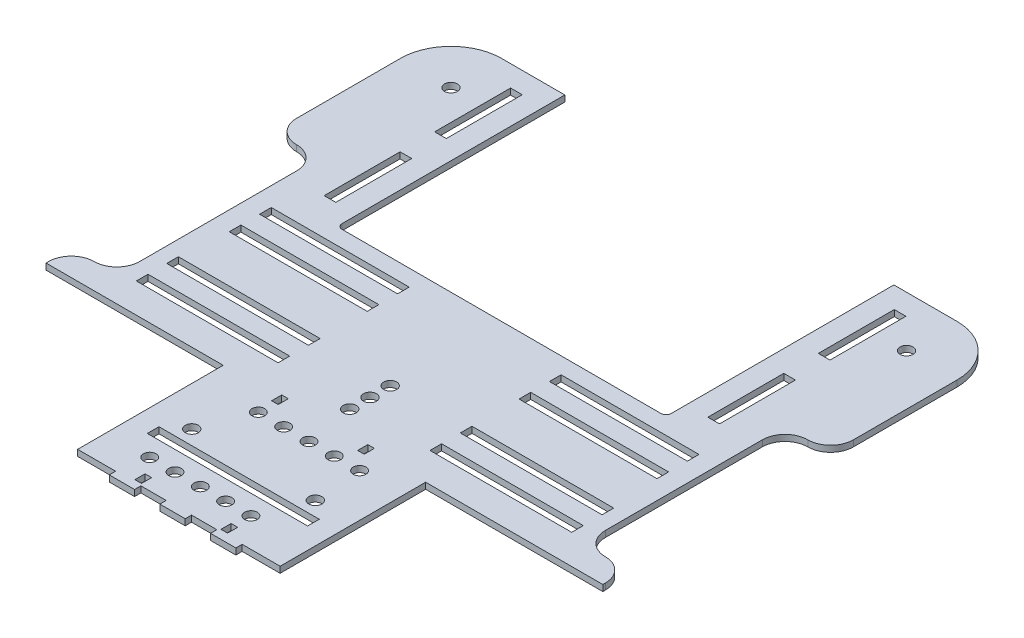
from build123d import *

# Parameters (mm, degrees)
SKETCH1_W                           = 279.4
SKETCH1_H                           = 279.4
BOSS_EXTRUDE1_DEPTH                 = 3.0988
WHEEL_WELLS_CUT_EXTRUDE2_REACH      = 199.59
SKETCH4_W                           = 22.86
SKETCH4_H                           = 101.6
FILLET1_START                       = -1
FILLET1_DEPTH                       = 5
FILLET1_2_DEPTH                     = 3.0988
SHAFT_HOLES_CUT_EXTRUDE4_REACH      = 199.59
SKETCH6_R                           = 3.2639
FILLET2_R                           = 25.4
COLLECTOR_CUTOUT_CUT_EXTRUDE5_REACH = 199.59
SKETCH7_W                           = 165.1
SKETCH7_H                           = 114.3
CUT_EXTRUDE11_REACH                 = 199.59
SKETCH26_W                          = 88.9
SKETCH26_H                          = 76.2
FILLET6_R                           = 2.54
CUT_EXTRUDE15_REACH                 = 199.59
SKETCH36_W                          = 71.12
SKETCH36_H                          = 5.842
SKETCH36_W_2                        = 69.208206015
CUT_EXTRUDE16_REACH                 = 199.59
SKETCH37_W                          = 19.05
SKETCH37_H                          = 3.175
SKETCH37_W_2                        = 12.7
CUT_EXTRUDE17_REACH                 = 199.59
SKETCH35_W                          = 3.302
SKETCH35_H                          = 5.08
SKETCH35_W_2                        = 80.428869842
SKETCH35_H_2                        = 5.842
CUT_EXTRUDE18_REACH                 = 199.59
SKETCH38_R                          = 3.175
CUT_EXTRUDE19_REACH                 = 199.59
SKETCH39_W                          = 5.842
SKETCH39_H                          = 38.1


with BuildPart() as part:
    # Sketch1 → Boss-Extrude1 (new body)
    with BuildSketch(Plane(origin=(0, 0, 0), x_dir=(1, 0, 0), z_dir=(0, 1, 0))):
        Rectangle(SKETCH1_W, SKETCH1_H)
    extrude(amount=BOSS_EXTRUDE1_DEPTH)

    # Sketch4 → WHEEL_WELLS_Cut-Extrude2 (cut, up to next)
    with BuildSketch(Plane(origin=(0, 3.0988, 0), x_dir=(1, 0, 0), z_dir=(0, 1, 0)), mode=Mode.PRIVATE) as wheel_wells_cut_extrude2_sk1:
        with Locations((-128.27, 0)):
            Rectangle(SKETCH4_W, SKETCH4_H)
    wheel_wells_cut_extrude2_tool1 = extrude(wheel_wells_cut_extrude2_sk1.sketch, amount=-WHEEL_WELLS_CUT_EXTRUDE2_REACH, mode=Mode.PRIVATE) & part.part
    # Sketch4 → WHEEL_WELLS_Cut-Extrude2 (cut, up to next)
    with BuildSketch(Plane(origin=(0, 3.0988, 0), x_dir=(1, 0, 0), z_dir=(0, 1, 0)), mode=Mode.PRIVATE) as wheel_wells_cut_extrude2_sk2:
        with Locations((128.27, 0)):
            Rectangle(SKETCH4_W, SKETCH4_H)
    wheel_wells_cut_extrude2_tool2 = extrude(wheel_wells_cut_extrude2_sk2.sketch, amount=-WHEEL_WELLS_CUT_EXTRUDE2_REACH, mode=Mode.PRIVATE) & part.part
    add(wheel_wells_cut_extrude2_tool1.solids().sort_by_distance((-128.27, 3.0988, 0))[0], mode=Mode.SUBTRACT)
    add(wheel_wells_cut_extrude2_tool2.solids().sort_by_distance((128.27, 3.0988, 0))[0], mode=Mode.SUBTRACT)

    # Fillet1: read off the stored shape, not the designer's step
    # Fillet1 outline → Fillet1 (cut)
    with BuildSketch(Plane(origin=(0, 0, 0), x_dir=(1, 0, 0), z_dir=(0, 1, 0)).offset(FILLET1_START)):
        with BuildLine():
            ThreePointArc((-139.7, -62.23), (-136.352230509, -54.147769491), (-128.27, -50.8))
            Line((-128.27, -50.8), (-139.7, -50.8))
            Line((-139.7, -50.8), (-139.7, -62.23))
        make_face()
        with BuildLine():
            ThreePointArc((-128.27, 50.8), (-136.352230509, 54.147769491), (-139.7, 62.23))
            Line((-139.7, 62.23), (-139.7, 50.8))
            Line((-139.7, 50.8), (-128.27, 50.8))
        make_face()
        with BuildLine():
            Line((139.7, -50.8), (128.27, -50.8))
            ThreePointArc((128.27, -50.8), (136.352230509, -54.147769491), (139.7, -62.23))
            Line((139.7, -62.23), (139.7, -50.8))
        make_face()
        with BuildLine():
            ThreePointArc((139.7, 62.23), (136.352230509, 54.147769491), (128.27, 50.8))
            Line((128.27, 50.8), (139.7, 50.8))
            Line((139.7, 50.8), (139.7, 62.23))
        make_face()
    extrude(amount=FILLET1_DEPTH, mode=Mode.SUBTRACT)

    # Fillet1 2 outline → Fillet1 2 (add)
    with BuildSketch(Plane(origin=(0, 0, 0), x_dir=(1, 0, 0), z_dir=(0, 1, 0))):
        with BuildLine():
            Line((-116.84, -50.8), (-116.84, -39.37))
            ThreePointArc((-116.84, -39.37), (-120.187769491, -47.452230509), (-128.27, -50.8))
            Line((-128.27, -50.8), (-116.84, -50.8))
        make_face()
        with BuildLine():
            Line((-116.84, 50.8), (-128.27, 50.8))
            ThreePointArc((-128.27, 50.8), (-120.187769491, 47.452230509), (-116.84, 39.37))
            Line((-116.84, 39.37), (-116.84, 50.8))
        make_face()
        with BuildLine():
            Line((116.84, -50.8), (128.27, -50.8))
            ThreePointArc((128.27, -50.8), (120.187769491, -47.452230509), (116.84, -39.37))
            Line((116.84, -39.37), (116.84, -50.8))
        make_face()
        with BuildLine():
            Line((116.84, 50.8), (116.84, 39.37))
            ThreePointArc((116.84, 39.37), (120.187769491, 47.452230509), (128.27, 50.8))
            Line((128.27, 50.8), (116.84, 50.8))
        make_face()
    extrude(amount=FILLET1_2_DEPTH)

    # Sketch6 → SHAFT_HOLES_Cut-Extrude4 (cut, up to next)
    with BuildSketch(Plane(origin=(0, 3.0988, 0), x_dir=(1, 0, 0), z_dir=(0, 1, 0)), mode=Mode.PRIVATE) as shaft_holes_cut_extrude4_sk1:
        with Locations(Location((-114.3, 114.3, 0), (0, 0, 270))):
            Circle(SKETCH6_R)
    shaft_holes_cut_extrude4_tool1 = extrude(shaft_holes_cut_extrude4_sk1.sketch, amount=-SHAFT_HOLES_CUT_EXTRUDE4_REACH, mode=Mode.PRIVATE) & part.part
    # Sketch6 → SHAFT_HOLES_Cut-Extrude4 (cut, up to next)
    with BuildSketch(Plane(origin=(0, 3.0988, 0), x_dir=(1, 0, 0), z_dir=(0, 1, 0)), mode=Mode.PRIVATE) as shaft_holes_cut_extrude4_sk2:
        with Locations(Location((114.3, 114.3, 0), (0, 0, 270))):
            Circle(SKETCH6_R)
    shaft_holes_cut_extrude4_tool2 = extrude(shaft_holes_cut_extrude4_sk2.sketch, amount=-SHAFT_HOLES_CUT_EXTRUDE4_REACH, mode=Mode.PRIVATE) & part.part
    # Sketch6 → SHAFT_HOLES_Cut-Extrude4 (cut, up to next)
    with BuildSketch(Plane(origin=(0, 3.0988, 0), x_dir=(1, 0, 0), z_dir=(0, 1, 0)), mode=Mode.PRIVATE) as shaft_holes_cut_extrude4_sk3:
        with Locations(Location((114.3, -114.3, 0), (0, 0, 270))):
            Circle(SKETCH6_R)
    shaft_holes_cut_extrude4_tool3 = extrude(shaft_holes_cut_extrude4_sk3.sketch, amount=-SHAFT_HOLES_CUT_EXTRUDE4_REACH, mode=Mode.PRIVATE) & part.part
    # Sketch6 → SHAFT_HOLES_Cut-Extrude4 (cut, up to next)
    with BuildSketch(Plane(origin=(0, 3.0988, 0), x_dir=(1, 0, 0), z_dir=(0, 1, 0)), mode=Mode.PRIVATE) as shaft_holes_cut_extrude4_sk4:
        with Locations(Location((-114.3, -114.3, 0), (0, 0, 270))):
            Circle(SKETCH6_R)
    shaft_holes_cut_extrude4_tool4 = extrude(shaft_holes_cut_extrude4_sk4.sketch, amount=-SHAFT_HOLES_CUT_EXTRUDE4_REACH, mode=Mode.PRIVATE) & part.part
    # Sketch6 → SHAFT_HOLES_Cut-Extrude4 (cut, up to next)
    with BuildSketch(Plane(origin=(0, 3.0988, 0), x_dir=(1, 0, 0), z_dir=(0, 1, 0)), mode=Mode.PRIVATE) as shaft_holes_cut_extrude4_sk5:
        with Locations(Location((0, -50.8, 0), (0, 0, 270))):
            Circle(SKETCH6_R)
    shaft_holes_cut_extrude4_tool5 = extrude(shaft_holes_cut_extrude4_sk5.sketch, amount=-SHAFT_HOLES_CUT_EXTRUDE4_REACH, mode=Mode.PRIVATE) & part.part
    # Sketch6 → SHAFT_HOLES_Cut-Extrude4 (cut, up to next)
    with BuildSketch(Plane(origin=(0, 3.0988, 0), x_dir=(1, 0, 0), z_dir=(0, 1, 0)), mode=Mode.PRIVATE) as shaft_holes_cut_extrude4_sk6:
        with Locations(Location((0, -40.64, 0), (0, 0, 270))):
            Circle(SKETCH6_R)
    shaft_holes_cut_extrude4_tool6 = extrude(shaft_holes_cut_extrude4_sk6.sketch, amount=-SHAFT_HOLES_CUT_EXTRUDE4_REACH, mode=Mode.PRIVATE) & part.part
    # Sketch6 → SHAFT_HOLES_Cut-Extrude4 (cut, up to next)
    with BuildSketch(Plane(origin=(0, 3.0988, 0), x_dir=(1, 0, 0), z_dir=(0, 1, 0)), mode=Mode.PRIVATE) as shaft_holes_cut_extrude4_sk7:
        with Locations(Location((0, -30.48, 0), (0, 0, 270))):
            Circle(SKETCH6_R)
    shaft_holes_cut_extrude4_tool7 = extrude(shaft_holes_cut_extrude4_sk7.sketch, amount=-SHAFT_HOLES_CUT_EXTRUDE4_REACH, mode=Mode.PRIVATE) & part.part
    # Sketch6 → SHAFT_HOLES_Cut-Extrude4 (cut, up to next)
    with BuildSketch(Plane(origin=(0, 3.0988, 0), x_dir=(1, 0, 0), z_dir=(0, 1, 0)), mode=Mode.PRIVATE) as shaft_holes_cut_extrude4_sk8:
        with Locations(Location((-30.988, -99.06, 0), (0, 0, 270))):
            Circle(SKETCH6_R)
    shaft_holes_cut_extrude4_tool8 = extrude(shaft_holes_cut_extrude4_sk8.sketch, amount=-SHAFT_HOLES_CUT_EXTRUDE4_REACH, mode=Mode.PRIVATE) & part.part
    # Sketch6 → SHAFT_HOLES_Cut-Extrude4 (cut, up to next)
    with BuildSketch(Plane(origin=(0, 3.0988, 0), x_dir=(1, 0, 0), z_dir=(0, 1, 0)), mode=Mode.PRIVATE) as shaft_holes_cut_extrude4_sk9:
        with Locations(Location((30.988, -99.06, 0), (0, 0, 270))):
            Circle(SKETCH6_R)
    shaft_holes_cut_extrude4_tool9 = extrude(shaft_holes_cut_extrude4_sk9.sketch, amount=-SHAFT_HOLES_CUT_EXTRUDE4_REACH, mode=Mode.PRIVATE) & part.part
    add(shaft_holes_cut_extrude4_tool1.solids().sort_by_distance((-114.3, 3.0988, -114.3))[0], mode=Mode.SUBTRACT)
    add(shaft_holes_cut_extrude4_tool2.solids().sort_by_distance((114.3, 3.0988, -114.3))[0], mode=Mode.SUBTRACT)
    add(shaft_holes_cut_extrude4_tool3.solids().sort_by_distance((114.3, 3.0988, 114.3))[0], mode=Mode.SUBTRACT)
    add(shaft_holes_cut_extrude4_tool4.solids().sort_by_distance((-114.3, 3.0988, 114.3))[0], mode=Mode.SUBTRACT)
    add(shaft_holes_cut_extrude4_tool5.solids().sort_by_distance((0, 3.0988, 50.8))[0], mode=Mode.SUBTRACT)
    add(shaft_holes_cut_extrude4_tool6.solids().sort_by_distance((0, 3.0988, 40.64))[0], mode=Mode.SUBTRACT)
    add(shaft_holes_cut_extrude4_tool7.solids().sort_by_distance((0, 3.0988, 30.48))[0], mode=Mode.SUBTRACT)
    add(shaft_holes_cut_extrude4_tool8.solids().sort_by_distance((-30.988, 3.0988, 99.06))[0], mode=Mode.SUBTRACT)
    add(shaft_holes_cut_extrude4_tool9.solids().sort_by_distance((30.988, 3.0988, 99.06))[0], mode=Mode.SUBTRACT)

    # Fillet2
    fillet2_edges = [part.edges().sort_by_distance(p)[0] for p in [
        (-139.7, 1.5494, -139.7),
        (139.7, 1.5494, -139.7),
        (139.7, 1.5494, 139.7),
        (-139.7, 1.5494, 139.7),
    ]]
    fillet(fillet2_edges, radius=FILLET2_R)

    # Sketch7 → COLLECTOR_CUTOUT_Cut-Extrude5 (cut, up to next)
    with BuildSketch(Plane(origin=(0, 3.0988, 0), x_dir=(1, 0, 0), z_dir=(0, 1, 0)), mode=Mode.PRIVATE) as collector_cutout_cut_extrude5_sk1:
        with Locations((0, 82.55)):
            Rectangle(SKETCH7_W, SKETCH7_H)
    collector_cutout_cut_extrude5_tool1 = extrude(collector_cutout_cut_extrude5_sk1.sketch, amount=-COLLECTOR_CUTOUT_CUT_EXTRUDE5_REACH, mode=Mode.PRIVATE) & part.part
    add(collector_cutout_cut_extrude5_tool1.solids().sort_by_distance((0, 3.0988, -82.55))[0], mode=Mode.SUBTRACT)

    # Sketch26 → Cut-Extrude11 (cut, up to next)
    with BuildSketch(Plane(origin=(0, 3.0988, 0), x_dir=(1, 0, 0), z_dir=(0, 1, 0)), mode=Mode.PRIVATE) as cut_extrude11_sk1:
        with Locations((-95.25, -101.6)):
            Rectangle(SKETCH26_W, SKETCH26_H)
    cut_extrude11_tool1 = extrude(cut_extrude11_sk1.sketch, amount=-CUT_EXTRUDE11_REACH, mode=Mode.PRIVATE) & part.part
    # Sketch26 → Cut-Extrude11 (cut, up to next)
    with BuildSketch(Plane(origin=(0, 3.0988, 0), x_dir=(1, 0, 0), z_dir=(0, 1, 0)), mode=Mode.PRIVATE) as cut_extrude11_sk2:
        with Locations((95.25, -101.6)):
            Rectangle(SKETCH26_W, SKETCH26_H)
    cut_extrude11_tool2 = extrude(cut_extrude11_sk2.sketch, amount=-CUT_EXTRUDE11_REACH, mode=Mode.PRIVATE) & part.part
    add(cut_extrude11_tool1.solids().sort_by_distance((-95.25, 3.0988, 101.6))[0], mode=Mode.SUBTRACT)
    add(cut_extrude11_tool2.solids().sort_by_distance((95.25, 3.0988, 101.6))[0], mode=Mode.SUBTRACT)

    # Fillet6
    fillet6_edges = [part.edges().sort_by_distance(p)[0] for p in [
        (-82.55, 1.5494, -25.4),
        (82.55, 1.5494, -25.4),
    ]]
    fillet(fillet6_edges, radius=FILLET6_R)

    # Sketch36 → Cut-Extrude15 (cut, up to next)
    with BuildSketch(Plane(origin=(0, 3.0988, 0), x_dir=(1, 0, 0), z_dir=(0, 1, 0)), mode=Mode.PRIVATE) as cut_extrude15_sk1:
        with Locations((-73.66, -30.48)):
            Rectangle(SKETCH36_W, SKETCH36_H)
    cut_extrude15_tool1 = extrude(cut_extrude15_sk1.sketch, amount=-CUT_EXTRUDE15_REACH, mode=Mode.PRIVATE) & part.part
    # Sketch36 → Cut-Extrude15 (cut, up to next)
    with BuildSketch(Plane(origin=(0, 3.0988, 0), x_dir=(1, 0, 0), z_dir=(0, 1, 0)), mode=Mode.PRIVATE) as cut_extrude15_sk2:
        with Locations((-73.66, -45.72)):
            Rectangle(SKETCH36_W, SKETCH36_H)
    cut_extrude15_tool2 = extrude(cut_extrude15_sk2.sketch, amount=-CUT_EXTRUDE15_REACH, mode=Mode.PRIVATE) & part.part
    # Sketch36 → Cut-Extrude15 (cut, up to next)
    with BuildSketch(Plane(origin=(0, 3.0988, 0), x_dir=(1, 0, 0), z_dir=(0, 1, 0)), mode=Mode.PRIVATE) as cut_extrude15_sk3:
        with Locations((73.66, -45.72)):
            Rectangle(SKETCH36_W, SKETCH36_H)
    cut_extrude15_tool3 = extrude(cut_extrude15_sk3.sketch, amount=-CUT_EXTRUDE15_REACH, mode=Mode.PRIVATE) & part.part
    # Sketch36 → Cut-Extrude15 (cut, up to next)
    with BuildSketch(Plane(origin=(0, 3.0988, 0), x_dir=(1, 0, 0), z_dir=(0, 1, 0)), mode=Mode.PRIVATE) as cut_extrude15_sk4:
        with Locations((73.66, -30.48)):
            Rectangle(SKETCH36_W, SKETCH36_H)
    cut_extrude15_tool4 = extrude(cut_extrude15_sk4.sketch, amount=-CUT_EXTRUDE15_REACH, mode=Mode.PRIVATE) & part.part
    # Sketch36 → Cut-Extrude15 (cut, up to next)
    with BuildSketch(Plane(origin=(0, 3.0988, 0), x_dir=(1, 0, 0), z_dir=(0, 1, 0)), mode=Mode.PRIVATE) as cut_extrude15_sk5:
        with Locations((-72.704103008, 14.224)):
            Rectangle(SKETCH36_W_2, SKETCH36_H)
    cut_extrude15_tool5 = extrude(cut_extrude15_sk5.sketch, amount=-CUT_EXTRUDE15_REACH, mode=Mode.PRIVATE) & part.part
    # Sketch36 → Cut-Extrude15 (cut, up to next)
    with BuildSketch(Plane(origin=(0, 3.0988, 0), x_dir=(1, 0, 0), z_dir=(0, 1, 0)), mode=Mode.PRIVATE) as cut_extrude15_sk6:
        with Locations((72.704103008, -1.016)):
            Rectangle(SKETCH36_W_2, SKETCH36_H)
    cut_extrude15_tool6 = extrude(cut_extrude15_sk6.sketch, amount=-CUT_EXTRUDE15_REACH, mode=Mode.PRIVATE) & part.part
    # Sketch36 → Cut-Extrude15 (cut, up to next)
    with BuildSketch(Plane(origin=(0, 3.0988, 0), x_dir=(1, 0, 0), z_dir=(0, 1, 0)), mode=Mode.PRIVATE) as cut_extrude15_sk7:
        with Locations((-72.704103008, -1.016)):
            Rectangle(SKETCH36_W_2, SKETCH36_H)
    cut_extrude15_tool7 = extrude(cut_extrude15_sk7.sketch, amount=-CUT_EXTRUDE15_REACH, mode=Mode.PRIVATE) & part.part
    # Sketch36 → Cut-Extrude15 (cut, up to next)
    with BuildSketch(Plane(origin=(0, 3.0988, 0), x_dir=(1, 0, 0), z_dir=(0, 1, 0)), mode=Mode.PRIVATE) as cut_extrude15_sk8:
        with Locations((72.704103008, 14.224)):
            Rectangle(SKETCH36_W_2, SKETCH36_H)
    cut_extrude15_tool8 = extrude(cut_extrude15_sk8.sketch, amount=-CUT_EXTRUDE15_REACH, mode=Mode.PRIVATE) & part.part
    add(cut_extrude15_tool1.solids().sort_by_distance((-73.66, 3.0988, 30.48))[0], mode=Mode.SUBTRACT)
    add(cut_extrude15_tool2.solids().sort_by_distance((-73.66, 3.0988, 45.72))[0], mode=Mode.SUBTRACT)
    add(cut_extrude15_tool3.solids().sort_by_distance((73.66, 3.0988, 45.72))[0], mode=Mode.SUBTRACT)
    add(cut_extrude15_tool4.solids().sort_by_distance((73.66, 3.0988, 30.48))[0], mode=Mode.SUBTRACT)
    add(cut_extrude15_tool5.solids().sort_by_distance((-72.704103, 3.0988, -14.224))[0], mode=Mode.SUBTRACT)
    add(cut_extrude15_tool6.solids().sort_by_distance((72.704103, 3.0988, 1.016))[0], mode=Mode.SUBTRACT)
    add(cut_extrude15_tool7.solids().sort_by_distance((-72.704103, 3.0988, 1.016))[0], mode=Mode.SUBTRACT)
    add(cut_extrude15_tool8.solids().sort_by_distance((72.704103, 3.0988, -14.224))[0], mode=Mode.SUBTRACT)

    # Sketch37 → Cut-Extrude16 (cut, up to next)
    with BuildSketch(Plane(origin=(0, 3.0988, 0), x_dir=(1, 0, 0), z_dir=(0, 1, 0)), mode=Mode.PRIVATE) as cut_extrude16_sk1:
        with Locations((-41.275, -138.1125)):
            Rectangle(SKETCH37_W, SKETCH37_H)
    cut_extrude16_tool1 = extrude(cut_extrude16_sk1.sketch, amount=-CUT_EXTRUDE16_REACH, mode=Mode.PRIVATE) & part.part
    # Sketch37 → Cut-Extrude16 (cut, up to next)
    with BuildSketch(Plane(origin=(0, 3.0988, 0), x_dir=(1, 0, 0), z_dir=(0, 1, 0)), mode=Mode.PRIVATE) as cut_extrude16_sk2:
        with Locations((-12.7, -138.1125)):
            Rectangle(SKETCH37_W_2, SKETCH37_H)
    cut_extrude16_tool2 = extrude(cut_extrude16_sk2.sketch, amount=-CUT_EXTRUDE16_REACH, mode=Mode.PRIVATE) & part.part
    # Sketch37 → Cut-Extrude16 (cut, up to next)
    with BuildSketch(Plane(origin=(0, 3.0988, 0), x_dir=(1, 0, 0), z_dir=(0, 1, 0)), mode=Mode.PRIVATE) as cut_extrude16_sk3:
        with Locations((12.7, -138.1125)):
            Rectangle(SKETCH37_W_2, SKETCH37_H)
    cut_extrude16_tool3 = extrude(cut_extrude16_sk3.sketch, amount=-CUT_EXTRUDE16_REACH, mode=Mode.PRIVATE) & part.part
    # Sketch37 → Cut-Extrude16 (cut, up to next)
    with BuildSketch(Plane(origin=(0, 3.0988, 0), x_dir=(1, 0, 0), z_dir=(0, 1, 0)), mode=Mode.PRIVATE) as cut_extrude16_sk4:
        with Locations((41.275, -138.1125)):
            Rectangle(SKETCH37_W, SKETCH37_H)
    cut_extrude16_tool4 = extrude(cut_extrude16_sk4.sketch, amount=-CUT_EXTRUDE16_REACH, mode=Mode.PRIVATE) & part.part
    add(cut_extrude16_tool1.solids().sort_by_distance((-41.275, 3.0988, 138.1125))[0], mode=Mode.SUBTRACT)
    add(cut_extrude16_tool2.solids().sort_by_distance((-12.7, 3.0988, 138.1125))[0], mode=Mode.SUBTRACT)
    add(cut_extrude16_tool3.solids().sort_by_distance((12.7, 3.0988, 138.1125))[0], mode=Mode.SUBTRACT)
    add(cut_extrude16_tool4.solids().sort_by_distance((41.275, 3.0988, 138.1125))[0], mode=Mode.SUBTRACT)

    # Sketch35 → Cut-Extrude17 (cut, up to next)
    with BuildSketch(Plane(origin=(0, 3.0988, 0), x_dir=(1, 0, 0), z_dir=(0, 1, 0)), mode=Mode.PRIVATE) as cut_extrude17_sk1:
        with Locations((-21.59, -64.217330442)):
            Rectangle(SKETCH35_W, SKETCH35_H)
    cut_extrude17_tool1 = extrude(cut_extrude17_sk1.sketch, amount=-CUT_EXTRUDE17_REACH, mode=Mode.PRIVATE) & part.part
    # Sketch35 → Cut-Extrude17 (cut, up to next)
    with BuildSketch(Plane(origin=(0, 3.0988, 0), x_dir=(1, 0, 0), z_dir=(0, 1, 0)), mode=Mode.PRIVATE) as cut_extrude17_sk2:
        with Locations((-21.59, -132.797330442)):
            Rectangle(SKETCH35_W, SKETCH35_H)
    cut_extrude17_tool2 = extrude(cut_extrude17_sk2.sketch, amount=-CUT_EXTRUDE17_REACH, mode=Mode.PRIVATE) & part.part
    # Sketch35 → Cut-Extrude17 (cut, up to next)
    with BuildSketch(Plane(origin=(0, 3.0988, 0), x_dir=(1, 0, 0), z_dir=(0, 1, 0)), mode=Mode.PRIVATE) as cut_extrude17_sk3:
        with Locations((21.59, -132.797330442)):
            Rectangle(SKETCH35_W, SKETCH35_H)
    cut_extrude17_tool3 = extrude(cut_extrude17_sk3.sketch, amount=-CUT_EXTRUDE17_REACH, mode=Mode.PRIVATE) & part.part
    # Sketch35 → Cut-Extrude17 (cut, up to next)
    with BuildSketch(Plane(origin=(0, 3.0988, 0), x_dir=(1, 0, 0), z_dir=(0, 1, 0)), mode=Mode.PRIVATE) as cut_extrude17_sk4:
        with Locations((21.59, -64.217330442)):
            Rectangle(SKETCH35_W, SKETCH35_H)
    cut_extrude17_tool4 = extrude(cut_extrude17_sk4.sketch, amount=-CUT_EXTRUDE17_REACH, mode=Mode.PRIVATE) & part.part
    # Sketch35 → Cut-Extrude17 (cut, up to next)
    with BuildSketch(Plane(origin=(0, 3.0988, 0), x_dir=(1, 0, 0), z_dir=(0, 1, 0)), mode=Mode.PRIVATE) as cut_extrude17_sk5:
        with Locations((0, -109.22)):
            Rectangle(SKETCH35_W_2, SKETCH35_H_2)
    cut_extrude17_tool5 = extrude(cut_extrude17_sk5.sketch, amount=-CUT_EXTRUDE17_REACH, mode=Mode.PRIVATE) & part.part
    add(cut_extrude17_tool1.solids().sort_by_distance((-21.59, 3.0988, 64.21733))[0], mode=Mode.SUBTRACT)
    add(cut_extrude17_tool2.solids().sort_by_distance((-21.59, 3.0988, 132.79733))[0], mode=Mode.SUBTRACT)
    add(cut_extrude17_tool3.solids().sort_by_distance((21.59, 3.0988, 132.79733))[0], mode=Mode.SUBTRACT)
    add(cut_extrude17_tool4.solids().sort_by_distance((21.59, 3.0988, 64.21733))[0], mode=Mode.SUBTRACT)
    add(cut_extrude17_tool5.solids().sort_by_distance((0, 3.0988, 109.22))[0], mode=Mode.SUBTRACT)

    # Sketch38 → Cut-Extrude18 (cut, up to next)
    with BuildSketch(Plane(origin=(0, 3.0988, 0), x_dir=(1, 0, 0), z_dir=(0, 1, 0)), mode=Mode.PRIVATE) as cut_extrude18_sk1:
        with Locations(Location((21.59, -121.958196273, 0), (0, 0, 270))):
            Circle(SKETCH38_R)
    cut_extrude18_tool1 = extrude(cut_extrude18_sk1.sketch, amount=-CUT_EXTRUDE18_REACH, mode=Mode.PRIVATE) & part.part
    # Sketch38 → Cut-Extrude18 (cut, up to next)
    with BuildSketch(Plane(origin=(0, 3.0988, 0), x_dir=(1, 0, 0), z_dir=(0, 1, 0)), mode=Mode.PRIVATE) as cut_extrude18_sk2:
        with Locations(Location((-21.59, -75.063130442, 0), (0, 0, 270))):
            Circle(SKETCH38_R)
    cut_extrude18_tool2 = extrude(cut_extrude18_sk2.sketch, amount=-CUT_EXTRUDE18_REACH, mode=Mode.PRIVATE) & part.part
    # Sketch38 → Cut-Extrude18 (cut, up to next)
    with BuildSketch(Plane(origin=(0, 3.0988, 0), x_dir=(1, 0, 0), z_dir=(0, 1, 0)), mode=Mode.PRIVATE) as cut_extrude18_sk3:
        with Locations(Location((8.89, -121.958196273, 0), (0, 0, 270))):
            Circle(SKETCH38_R)
    cut_extrude18_tool3 = extrude(cut_extrude18_sk3.sketch, amount=-CUT_EXTRUDE18_REACH, mode=Mode.PRIVATE) & part.part
    # Sketch38 → Cut-Extrude18 (cut, up to next)
    with BuildSketch(Plane(origin=(0, 3.0988, 0), x_dir=(1, 0, 0), z_dir=(0, 1, 0)), mode=Mode.PRIVATE) as cut_extrude18_sk4:
        with Locations(Location((-3.81, -121.958196273, 0), (0, 0, 270))):
            Circle(SKETCH38_R)
    cut_extrude18_tool4 = extrude(cut_extrude18_sk4.sketch, amount=-CUT_EXTRUDE18_REACH, mode=Mode.PRIVATE) & part.part
    # Sketch38 → Cut-Extrude18 (cut, up to next)
    with BuildSketch(Plane(origin=(0, 3.0988, 0), x_dir=(1, 0, 0), z_dir=(0, 1, 0)), mode=Mode.PRIVATE) as cut_extrude18_sk5:
        with Locations(Location((-16.51, -121.958196273, 0), (0, 0, 270))):
            Circle(SKETCH38_R)
    cut_extrude18_tool5 = extrude(cut_extrude18_sk5.sketch, amount=-CUT_EXTRUDE18_REACH, mode=Mode.PRIVATE) & part.part
    # Sketch38 → Cut-Extrude18 (cut, up to next)
    with BuildSketch(Plane(origin=(0, 3.0988, 0), x_dir=(1, 0, 0), z_dir=(0, 1, 0)), mode=Mode.PRIVATE) as cut_extrude18_sk6:
        with Locations(Location((-29.21, -121.958196273, 0), (0, 0, 270))):
            Circle(SKETCH38_R)
    cut_extrude18_tool6 = extrude(cut_extrude18_sk6.sketch, amount=-CUT_EXTRUDE18_REACH, mode=Mode.PRIVATE) & part.part
    # Sketch38 → Cut-Extrude18 (cut, up to next)
    with BuildSketch(Plane(origin=(0, 3.0988, 0), x_dir=(1, 0, 0), z_dir=(0, 1, 0)), mode=Mode.PRIVATE) as cut_extrude18_sk7:
        with Locations(Location((-8.89, -75.063130442, 0), (0, 0, 270))):
            Circle(SKETCH38_R)
    cut_extrude18_tool7 = extrude(cut_extrude18_sk7.sketch, amount=-CUT_EXTRUDE18_REACH, mode=Mode.PRIVATE) & part.part
    # Sketch38 → Cut-Extrude18 (cut, up to next)
    with BuildSketch(Plane(origin=(0, 3.0988, 0), x_dir=(1, 0, 0), z_dir=(0, 1, 0)), mode=Mode.PRIVATE) as cut_extrude18_sk8:
        with Locations(Location((3.81, -75.063130442, 0), (0, 0, 270))):
            Circle(SKETCH38_R)
    cut_extrude18_tool8 = extrude(cut_extrude18_sk8.sketch, amount=-CUT_EXTRUDE18_REACH, mode=Mode.PRIVATE) & part.part
    # Sketch38 → Cut-Extrude18 (cut, up to next)
    with BuildSketch(Plane(origin=(0, 3.0988, 0), x_dir=(1, 0, 0), z_dir=(0, 1, 0)), mode=Mode.PRIVATE) as cut_extrude18_sk9:
        with Locations(Location((16.51, -75.063130442, 0), (0, 0, 270))):
            Circle(SKETCH38_R)
    cut_extrude18_tool9 = extrude(cut_extrude18_sk9.sketch, amount=-CUT_EXTRUDE18_REACH, mode=Mode.PRIVATE) & part.part
    # Sketch38 → Cut-Extrude18 (cut, up to next)
    with BuildSketch(Plane(origin=(0, 3.0988, 0), x_dir=(1, 0, 0), z_dir=(0, 1, 0)), mode=Mode.PRIVATE) as cut_extrude18_sk10:
        with Locations(Location((29.21, -75.063130442, 0), (0, 0, 270))):
            Circle(SKETCH38_R)
    cut_extrude18_tool10 = extrude(cut_extrude18_sk10.sketch, amount=-CUT_EXTRUDE18_REACH, mode=Mode.PRIVATE) & part.part
    add(cut_extrude18_tool1.solids().sort_by_distance((21.59, 3.0988, 121.958196))[0], mode=Mode.SUBTRACT)
    add(cut_extrude18_tool2.solids().sort_by_distance((-21.59, 3.0988, 75.06313))[0], mode=Mode.SUBTRACT)
    add(cut_extrude18_tool3.solids().sort_by_distance((8.89, 3.0988, 121.958196))[0], mode=Mode.SUBTRACT)
    add(cut_extrude18_tool4.solids().sort_by_distance((-3.81, 3.0988, 121.958196))[0], mode=Mode.SUBTRACT)
    add(cut_extrude18_tool5.solids().sort_by_distance((-16.51, 3.0988, 121.958196))[0], mode=Mode.SUBTRACT)
    add(cut_extrude18_tool6.solids().sort_by_distance((-29.21, 3.0988, 121.958196))[0], mode=Mode.SUBTRACT)
    add(cut_extrude18_tool7.solids().sort_by_distance((-8.89, 3.0988, 75.06313))[0], mode=Mode.SUBTRACT)
    add(cut_extrude18_tool8.solids().sort_by_distance((3.81, 3.0988, 75.06313))[0], mode=Mode.SUBTRACT)
    add(cut_extrude18_tool9.solids().sort_by_distance((16.51, 3.0988, 75.06313))[0], mode=Mode.SUBTRACT)
    add(cut_extrude18_tool10.solids().sort_by_distance((29.21, 3.0988, 75.06313))[0], mode=Mode.SUBTRACT)

    # Sketch39 → Cut-Extrude19 (cut, up to next)
    with BuildSketch(Plane(origin=(0, 3.0988, 0), x_dir=(1, 0, 0), z_dir=(0, 1, 0)), mode=Mode.PRIVATE) as cut_extrude19_sk1:
        with Locations((96.266, 54.61)):
            Rectangle(SKETCH39_W, SKETCH39_H)
    cut_extrude19_tool1 = extrude(cut_extrude19_sk1.sketch, amount=-CUT_EXTRUDE19_REACH, mode=Mode.PRIVATE) & part.part
    # Sketch39 → Cut-Extrude19 (cut, up to next)
    with BuildSketch(Plane(origin=(0, 3.0988, 0), x_dir=(1, 0, 0), z_dir=(0, 1, 0)), mode=Mode.PRIVATE) as cut_extrude19_sk2:
        with Locations((-96.266, 54.61)):
            Rectangle(SKETCH39_W, SKETCH39_H)
    cut_extrude19_tool2 = extrude(cut_extrude19_sk2.sketch, amount=-CUT_EXTRUDE19_REACH, mode=Mode.PRIVATE) & part.part
    # Sketch39 → Cut-Extrude19 (cut, up to next)
    with BuildSketch(Plane(origin=(0, 3.0988, 0), x_dir=(1, 0, 0), z_dir=(0, 1, 0)), mode=Mode.PRIVATE) as cut_extrude19_sk3:
        with Locations((96.266, 110.053612516)):
            Rectangle(SKETCH39_W, SKETCH39_H)
    cut_extrude19_tool3 = extrude(cut_extrude19_sk3.sketch, amount=-CUT_EXTRUDE19_REACH, mode=Mode.PRIVATE) & part.part
    # Sketch39 → Cut-Extrude19 (cut, up to next)
    with BuildSketch(Plane(origin=(0, 3.0988, 0), x_dir=(1, 0, 0), z_dir=(0, 1, 0)), mode=Mode.PRIVATE) as cut_extrude19_sk4:
        with Locations((-96.266, 110.053612516)):
            Rectangle(SKETCH39_W, SKETCH39_H)
    cut_extrude19_tool4 = extrude(cut_extrude19_sk4.sketch, amount=-CUT_EXTRUDE19_REACH, mode=Mode.PRIVATE) & part.part
    add(cut_extrude19_tool1.solids().sort_by_distance((96.266, 3.0988, -54.61))[0], mode=Mode.SUBTRACT)
    add(cut_extrude19_tool2.solids().sort_by_distance((-96.266, 3.0988, -54.61))[0], mode=Mode.SUBTRACT)
    add(cut_extrude19_tool3.solids().sort_by_distance((96.266, 3.0988, -110.053613))[0], mode=Mode.SUBTRACT)
    add(cut_extrude19_tool4.solids().sort_by_distance((-96.266, 3.0988, -110.053613))[0], mode=Mode.SUBTRACT)


solid = part.part
